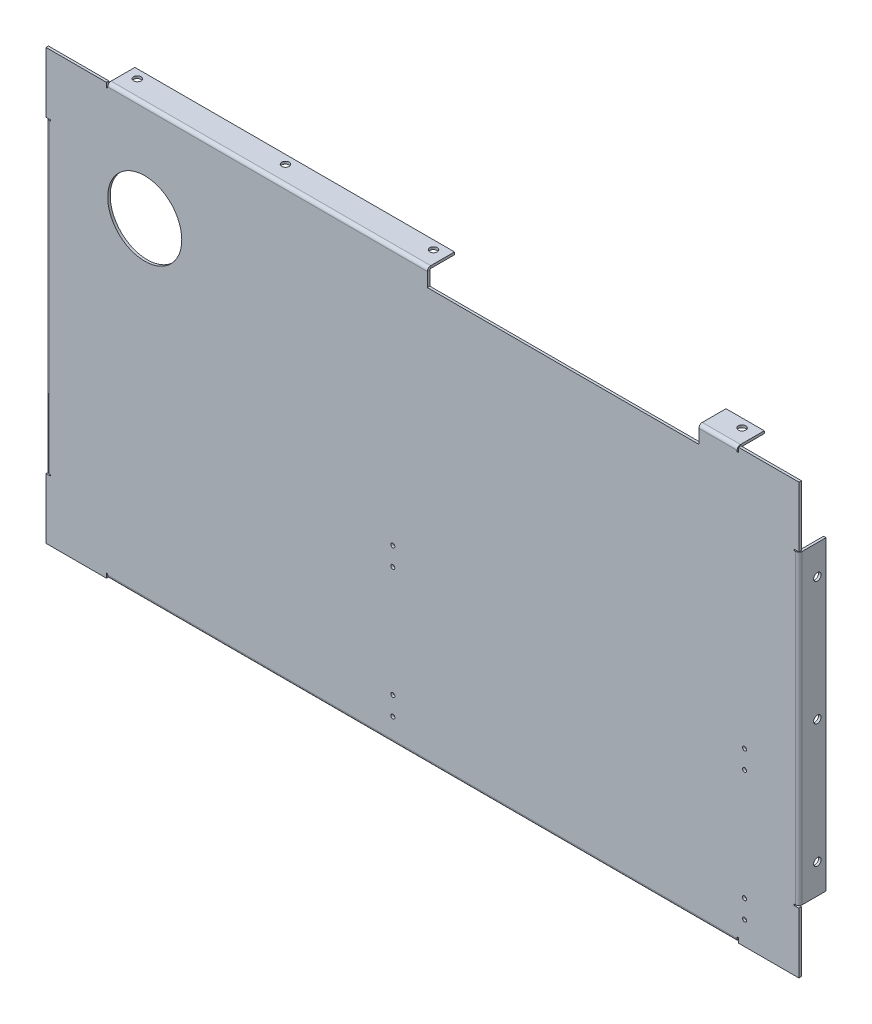
from build123d import *

# Parameters (mm, degrees)
SM_BASE_FLANGE_1_DEPTH            = 2
SM_EDGE_FLANGE_1_STRIP_W          = 9.4732
SM_EDGE_FLANGE_1_STRIP_H          = 2
SM_EDGE_FLANGE_1_STRIP_CUT_DEPTH  = 248
SM_EDGE_FLANGE_1_RELIEF_W         = 10.4732
SM_EDGE_FLANGE_1_RELIEF_H         = 1
SM_EDGE_FLANGE_1_RELIEF_CUT_DEPTH = 2
SM_EDGE_FLANGE_1_DEPTH            = 248
SM_EDGE_FLANGE_2_STRIP_W          = 9.4732
SM_EDGE_FLANGE_2_STRIP_H          = 2
SM_EDGE_FLANGE_2_STRIP_CUT_DEPTH  = 510
SM_EDGE_FLANGE_2_RELIEF_W         = 10.4732
SM_EDGE_FLANGE_2_RELIEF_H         = 1
SM_EDGE_FLANGE_2_RELIEF_CUT_DEPTH = 2
SM_EDGE_FLANGE_2_DEPTH            = 510
SM_EDGE_FLANGE_3_STRIP_W          = 9.4732
SM_EDGE_FLANGE_3_STRIP_H          = 2
SM_EDGE_FLANGE_3_STRIP_CUT_DEPTH  = 248
SM_EDGE_FLANGE_3_RELIEF_W         = 10.4732
SM_EDGE_FLANGE_3_RELIEF_H         = 1
SM_EDGE_FLANGE_3_RELIEF_CUT_DEPTH = 2
SM_EDGE_FLANGE_3_DEPTH            = 248
SM_EDGE_FLANGE_4_STRIP_W          = 9.4732
SM_EDGE_FLANGE_4_STRIP_H          = 2
SM_EDGE_FLANGE_4_STRIP_CUT_DEPTH  = 31
SM_EDGE_FLANGE_4_RELIEF_W         = 10.4732
SM_EDGE_FLANGE_4_RELIEF_H         = 1
SM_EDGE_FLANGE_4_RELIEF_CUT_DEPTH = 2
SM_EDGE_FLANGE_4_DEPTH            = 31
SM_EDGE_FLANGE_5_STRIP_W          = 9.4732
SM_EDGE_FLANGE_5_STRIP_H          = 2
SM_EDGE_FLANGE_5_STRIP_CUT_DEPTH  = 259
SM_EDGE_FLANGE_5_RELIEF_W         = 10.4732
SM_EDGE_FLANGE_5_RELIEF_H         = 1
SM_EDGE_FLANGE_5_RELIEF_CUT_DEPTH = 2
SM_EDGE_FLANGE_5_DEPTH            = 259
HOLE_WIZARD_M4_1_D                = 3.3
HOLE_WIZARD_M4_1_DEPTH            = 10.1
HOLE_WIZARD_M4_1_TIP              = 0.991420021
SKETCH_20_R                       = 3
CUT_EXTRUDE_1_DEPTH               = 635.712533357
SKETCH_21_R                       = 3
CUT_EXTRUDE_2_DEPTH               = 464.263423983
SKETCH_22_R                       = 30
CUT_EXTRUDE_3_DEPTH               = 352.830925304


# Sheet-metal steps are written as plain solids
with BuildPart() as part:
    # Sketch 1 → 基体-法兰1 (new body)
    with BuildSketch(Plane.XY):
        Polygon((224, 174), (305, 174), (305, -174), (-305, -174), (-305, 174), (4, 174), (4, 160), (224, 160), align=None)
    extrude(amount=-SM_BASE_FLANGE_1_DEPTH)

    # 边线-法兰1 strip (across the edge) → 边线-法兰1 strip cut (cut)
    with BuildSketch(Plane(origin=(305, 124, -2), x_dir=(-1, 0, 0), z_dir=(0, -1, 0))):
        with Locations((-2, -1)):
            Rectangle(SM_EDGE_FLANGE_1_STRIP_W, SM_EDGE_FLANGE_1_STRIP_H)
    extrude(amount=SM_EDGE_FLANGE_1_STRIP_CUT_DEPTH, mode=Mode.SUBTRACT)

    # 边线-法兰1 relief (on the sheet) → 边线-法兰1 relief cut (cut)
    with BuildSketch(Plane(origin=(302.2634, 124, -2), x_dir=(-1, 0, 0), z_dir=(0, 0, -1))):
        with Locations((-4.2366, 0.5)):
            Rectangle(SM_EDGE_FLANGE_1_RELIEF_W, SM_EDGE_FLANGE_1_RELIEF_H)
        with Locations((-4.2366, -248.5)):
            Rectangle(SM_EDGE_FLANGE_1_RELIEF_W, SM_EDGE_FLANGE_1_RELIEF_H)
    extrude(amount=-SM_EDGE_FLANGE_1_RELIEF_CUT_DEPTH, mode=Mode.SUBTRACT)

    # 边线-法兰1 section (across the edge) → 边线-法兰1 (add)
    with BuildSketch(Plane(origin=(305, 124, -2), x_dir=(-1, 0, 0), z_dir=(0, -1, 0))):
        with BuildLine():
            Line((0, 0.7366), (0, 20))
            Line((0, 20), (2, 20))
            Line((2, 20), (2, 0.7366))
            ThreePointArc((2, 0.7366), (2.215745145, 0.215745145), (2.7366, 0))
            Line((2.7366, 0), (2.7366, -2))
            ThreePointArc((2.7366, -2), (0.801531583, -1.198468417), (0, 0.7366))
        make_face()
    extrude(amount=SM_EDGE_FLANGE_1_DEPTH)

    # 边线-法兰2 strip (across the edge) → 边线-法兰2 strip cut (cut)
    with BuildSketch(Plane(origin=(255, -174, -2), x_dir=(0, 1, 0), z_dir=(-1, 0, 0))):
        with Locations((-2, -1)):
            Rectangle(SM_EDGE_FLANGE_2_STRIP_W, SM_EDGE_FLANGE_2_STRIP_H)
    extrude(amount=SM_EDGE_FLANGE_2_STRIP_CUT_DEPTH, mode=Mode.SUBTRACT)

    # 边线-法兰2 relief (on the sheet) → 边线-法兰2 relief cut (cut)
    with BuildSketch(Plane(origin=(255, -171.2634, -2), x_dir=(0, 1, 0), z_dir=(0, 0, -1))):
        with Locations((-4.2366, 0.5)):
            Rectangle(SM_EDGE_FLANGE_2_RELIEF_W, SM_EDGE_FLANGE_2_RELIEF_H)
        with Locations((-4.2366, -510.5)):
            Rectangle(SM_EDGE_FLANGE_2_RELIEF_W, SM_EDGE_FLANGE_2_RELIEF_H)
    extrude(amount=-SM_EDGE_FLANGE_2_RELIEF_CUT_DEPTH, mode=Mode.SUBTRACT)

    # 边线-法兰2 section (across the edge) → 边线-法兰2 (add)
    with BuildSketch(Plane(origin=(255, -174, -2), x_dir=(0, 1, 0), z_dir=(-1, 0, 0))):
        with BuildLine():
            Line((0, 0.7366), (0, 20))
            Line((0, 20), (2, 20))
            Line((2, 20), (2, 0.7366))
            ThreePointArc((2, 0.7366), (2.215745145, 0.215745145), (2.7366, 0))
            Line((2.7366, 0), (2.7366, -2))
            ThreePointArc((2.7366, -2), (0.801531583, -1.198468417), (0, 0.7366))
        make_face()
    extrude(amount=SM_EDGE_FLANGE_2_DEPTH)

    # 边线-法兰3 strip (across the edge) → 边线-法兰3 strip cut (cut)
    with BuildSketch(Plane(origin=(-305, -124, -2), x_dir=(1, 0, 0), z_dir=(0, 1, 0))):
        with Locations((-2, -1)):
            Rectangle(SM_EDGE_FLANGE_3_STRIP_W, SM_EDGE_FLANGE_3_STRIP_H)
    extrude(amount=SM_EDGE_FLANGE_3_STRIP_CUT_DEPTH, mode=Mode.SUBTRACT)

    # 边线-法兰3 relief (on the sheet) → 边线-法兰3 relief cut (cut)
    with BuildSketch(Plane(origin=(-302.2634, -124, -2), x_dir=(1, 0, 0), z_dir=(0, 0, -1))):
        with Locations((-4.2366, 0.5)):
            Rectangle(SM_EDGE_FLANGE_3_RELIEF_W, SM_EDGE_FLANGE_3_RELIEF_H)
        with Locations((-4.2366, -248.5)):
            Rectangle(SM_EDGE_FLANGE_3_RELIEF_W, SM_EDGE_FLANGE_3_RELIEF_H)
    extrude(amount=-SM_EDGE_FLANGE_3_RELIEF_CUT_DEPTH, mode=Mode.SUBTRACT)

    # 边线-法兰3 section (across the edge) → 边线-法兰3 (add)
    with BuildSketch(Plane(origin=(-305, -124, -2), x_dir=(1, 0, 0), z_dir=(0, 1, 0))):
        with BuildLine():
            Line((0, 0.7366), (0, 20))
            Line((0, 20), (2, 20))
            Line((2, 20), (2, 0.7366))
            ThreePointArc((2, 0.7366), (2.215745145, 0.215745145), (2.7366, 0))
            Line((2.7366, 0), (2.7366, -2))
            ThreePointArc((2.7366, -2), (0.801531583, -1.198468417), (0, 0.7366))
        make_face()
    extrude(amount=SM_EDGE_FLANGE_3_DEPTH)

    # 边线-法兰4 strip (across the edge) → 边线-法兰4 strip cut (cut)
    with BuildSketch(Plane(origin=(224, 174, -2), x_dir=(0, -1, 0), z_dir=(1, 0, 0))):
        with Locations((-2, -1)):
            Rectangle(SM_EDGE_FLANGE_4_STRIP_W, SM_EDGE_FLANGE_4_STRIP_H)
    extrude(amount=SM_EDGE_FLANGE_4_STRIP_CUT_DEPTH, mode=Mode.SUBTRACT)

    # 边线-法兰4 relief (on the sheet) → 边线-法兰4 relief cut (cut)
    with BuildSketch(Plane(origin=(224, 171.2634, -2), x_dir=(0, -1, 0), z_dir=(0, 0, -1))):
        with Locations((-4.2366, -31.5)):
            Rectangle(SM_EDGE_FLANGE_4_RELIEF_W, SM_EDGE_FLANGE_4_RELIEF_H)
    extrude(amount=-SM_EDGE_FLANGE_4_RELIEF_CUT_DEPTH, mode=Mode.SUBTRACT)

    # 边线-法兰4 section (across the edge) → 边线-法兰4 (add)
    with BuildSketch(Plane(origin=(224, 174, -2), x_dir=(0, -1, 0), z_dir=(1, 0, 0))):
        with BuildLine():
            Line((0, 0.7366), (0, 20))
            Line((0, 20), (2, 20))
            Line((2, 20), (2, 0.7366))
            ThreePointArc((2, 0.7366), (2.215745145, 0.215745145), (2.7366, 0))
            Line((2.7366, 0), (2.7366, -2))
            ThreePointArc((2.7366, -2), (0.801531583, -1.198468417), (0, 0.7366))
        make_face()
    extrude(amount=SM_EDGE_FLANGE_4_DEPTH)

    # 边线-法兰5 strip (across the edge) → 边线-法兰5 strip cut (cut)
    with BuildSketch(Plane(origin=(-255, 174, -2), x_dir=(0, -1, 0), z_dir=(1, 0, 0))):
        with Locations((-2, -1)):
            Rectangle(SM_EDGE_FLANGE_5_STRIP_W, SM_EDGE_FLANGE_5_STRIP_H)
    extrude(amount=SM_EDGE_FLANGE_5_STRIP_CUT_DEPTH, mode=Mode.SUBTRACT)

    # 边线-法兰5 relief (on the sheet) → 边线-法兰5 relief cut (cut)
    with BuildSketch(Plane(origin=(-255, 171.2634, -2), x_dir=(0, -1, 0), z_dir=(0, 0, -1))):
        with Locations((-4.2366, 0.5)):
            Rectangle(SM_EDGE_FLANGE_5_RELIEF_W, SM_EDGE_FLANGE_5_RELIEF_H)
    extrude(amount=-SM_EDGE_FLANGE_5_RELIEF_CUT_DEPTH, mode=Mode.SUBTRACT)

    # 边线-法兰5 section (across the edge) → 边线-法兰5 (add)
    with BuildSketch(Plane(origin=(-255, 174, -2), x_dir=(0, -1, 0), z_dir=(1, 0, 0))):
        with BuildLine():
            Line((0, 0.7366), (0, 20))
            Line((0, 20), (2, 20))
            Line((2, 20), (2, 0.7366))
            ThreePointArc((2, 0.7366), (2.215745145, 0.215745145), (2.7366, 0))
            Line((2.7366, 0), (2.7366, -2))
            ThreePointArc((2.7366, -2), (0.801531583, -1.198468417), (0, 0.7366))
        make_face()
    extrude(amount=SM_EDGE_FLANGE_5_DEPTH)

    # M4 螺纹孔1
    with Locations(Plane.XY):
        with Locations((-24, -155), (-24, -140), (-24, -50), (-24, -35), (261, -155), (261, -140), (261, -50), (261, -35)):
            Hole(HOLE_WIZARD_M4_1_D / 2, depth=HOLE_WIZARD_M4_1_DEPTH)
            with Locations((0, 0, -(HOLE_WIZARD_M4_1_DEPTH + HOLE_WIZARD_M4_1_TIP / 2))):  # 118° drill point
                Cone(0, HOLE_WIZARD_M4_1_D / 2, HOLE_WIZARD_M4_1_TIP, mode=Mode.SUBTRACT)

    # 草图20 → 切除-拉伸1 (cut, through all)
    with BuildSketch(Plane(origin=(305, 0, 0), x_dir=(0, 0, -1), z_dir=(1, 0, 0))):
        with Locations((15, 0)):
            Circle(SKETCH_20_R)
        with Locations((15, 100)):
            Circle(SKETCH_20_R)
        with Locations((15, -100)):
            Circle(SKETCH_20_R)
    extrude(amount=-CUT_EXTRUDE_1_DEPTH, mode=Mode.SUBTRACT)

    # 草图21 → 切除-拉伸2 (cut, through all)
    with BuildSketch(Plane.XZ.offset(174)):
        with Locations(Location((-246, -15, 0), (0, 0, 270))):
            Circle(SKETCH_21_R)
        with Locations(Location((-126, -15, 0), (0, 0, 270))):
            Circle(SKETCH_21_R)
        with Locations(Location((-6, -15, 0), (0, 0, 270))):
            Circle(SKETCH_21_R)
        with Locations(Location((244, -15, 0), (0, 0, 270))):
            Circle(SKETCH_21_R)
        with Locations(Location((119, -15, 0), (0, 0, 270))):
            Circle(SKETCH_21_R)
    extrude(amount=-CUT_EXTRUDE_2_DEPTH, mode=Mode.SUBTRACT)

    # 草图22 → 切除-拉伸3 (cut, through all)
    with BuildSketch(Plane.XY):
        with Locations((-225, 94)):
            Circle(SKETCH_22_R)
    extrude(amount=-CUT_EXTRUDE_3_DEPTH, mode=Mode.SUBTRACT)


solid = part.part
